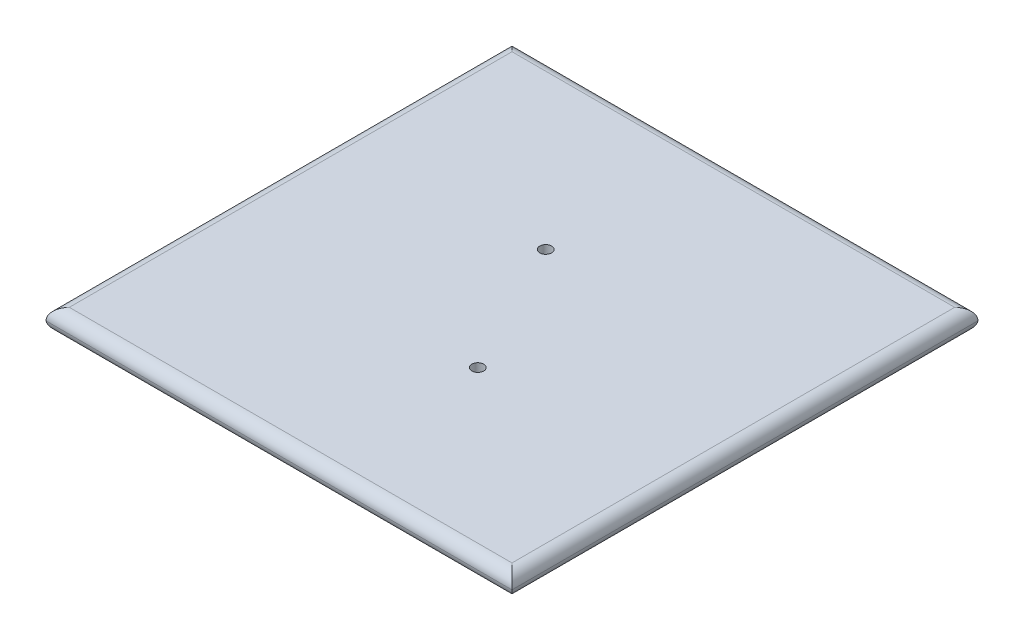
from build123d import *

# Parameters (mm, degrees)
SKETCH1_W                  = 53.594
SKETCH1_H                  = 46.99
BOSS_EXTRUDE1_DEPTH        = 12.7
CUT_EXTRUDE1_DEPTH         = 62.251008522
SKETCH3_W                  = 4.953
SKETCH3_H                  = 9.653808373
CUT_EXTRUDE2_DEPTH         = 56.564640816
SKETCH4_W                  = 53.594
SKETCH4_H                  = 46.99
BOSS_EXTRUDE2_DEPTH        = 3.175
SKETCH5_W                  = 101.6
SKETCH5_H                  = 101.6
BOSS_EXTRUDE3_DEPTH        = 4.7625
FILLET1_R                  = 7.62
SKETCH6_W                  = 41.148
SKETCH6_H                  = 34.415052436
CUT_EXTRUDE3_DEPTH         = 15.875
F_2_6_2_6_DIAMETER_HOLE1_D = 2.6
FILLET2_R                  = 2.54
FILLET3_R                  = 2.54
FILLET4_R                  = 2.54
BOSS_EXTRUDE4_REACH        = 76.747
SKETCH9_W                  = 41.148
SKETCH9_H                  = 21.115558174
FILLET5_R                  = 2.54


with BuildPart() as part:
    # Sketch1 → Boss-Extrude1 (new body)
    with BuildSketch(Plane(origin=(0, 0, 0), x_dir=(1, 0, 0), z_dir=(0, 1, 0))):
        Rectangle(SKETCH1_W, SKETCH1_H)
    extrude(amount=BOSS_EXTRUDE1_DEPTH)

    # Sketch2 → Cut-Extrude1 (cut, through all)
    with BuildSketch(Plane(origin=(-26.797, 0, -3.302), x_dir=(0, 0, -1), z_dir=(1, 0, 0))):
        Polygon((-25.781, 0), (-21.779526218, 8.503564639), (-21.779526218, 9.653808373), (-26.797, 9.653808373), (-26.797, 0), align=None)
        Polygon((19.177, 0), (20.193, 0), (20.193, 9.653808373), (15.175526218, 9.653808373), (15.175526218, 8.503564639), align=None)
    extrude(amount=CUT_EXTRUDE1_DEPTH, mode=Mode.SUBTRACT)

    # Sketch3 → Cut-Extrude2 (cut, through all)
    with BuildSketch(Plane.XY.offset(23.495)):
        with Locations((-24.3205, 4.826904187)):
            Rectangle(SKETCH3_W, SKETCH3_H)
        with Locations((24.3205, 4.826904187)):
            Rectangle(SKETCH3_W, SKETCH3_H)
    extrude(amount=-CUT_EXTRUDE2_DEPTH, mode=Mode.SUBTRACT)

    # Sketch4 → Boss-Extrude2 (add)
    with BuildSketch(Plane(origin=(0, 12.7, 0), x_dir=(1, 0, 0), z_dir=(0, 1, 0))):
        Rectangle(SKETCH4_W, SKETCH4_H)
    extrude(amount=BOSS_EXTRUDE2_DEPTH)

    # Sketch5 → Boss-Extrude3 (add)
    with BuildSketch(Plane(origin=(0, 15.875, 0), x_dir=(1, 0, 0), z_dir=(0, 1, 0))):
        Rectangle(SKETCH5_W, SKETCH5_H)
    extrude(amount=BOSS_EXTRUDE3_DEPTH)

    # Fillet1
    # the kernel refuses this fillet: 7.62 mm, written as the material it adds along each edge
    with BuildSketch(Plane(origin=(-26.797, 15.875, -23.495), x_dir=(-1, 0, 0), z_dir=(0, 0, 1)), Plane(origin=(26.797, 15.875, 23.495), x_dir=(1, 0, 0), z_dir=(0, 0, -1))) as fillet1_piece_1:
        with BuildLine():
            CenterArc((7.490509671, 7.62), FILLET1_R, 190.577809731, 79.422190269)
            Line((0, 6.221191627), (-0.149810193, 6.19321546))
            ThreePointArc((-0.149810193, 6.19321546), (-0.1524, 3.110595814), (-0.1524, 0))
            Line((-0.1524, 0), (0, -0.1524))
            Line((0, -0.1524), (7.490509671, -0.1524))
            Line((7.490509671, -0.1524), (7.490509671, 0))
        make_face()
    extrude(amount=46.99)
    with BuildSketch(Plane(origin=(26.797, 15.875, -23.495), x_dir=(0, 0, -1), z_dir=(-1, 0, 0)), Plane(origin=(-26.797, 15.875, 23.495), x_dir=(0, 0, 1), z_dir=(1, 0, 0))) as fillet1_piece_2:
        with BuildLine():
            CenterArc((7.490509671, 7.62), FILLET1_R, 190.577809731, 79.422190269)
            Line((0, 6.221191627), (-0.149810193, 6.19321546))
            ThreePointArc((-0.149810193, 6.19321546), (-0.1524, 3.110595814), (-0.1524, 0))
            Line((-0.1524, 0), (0, -0.1524))
            Line((0, -0.1524), (7.490509671, -0.1524))
            Line((7.490509671, -0.1524), (7.490509671, 0))
        make_face()
    extrude(amount=53.594)
    with BuildSketch(Plane(origin=(26.797, 15.875, -23.495), x_dir=(0, 0, -1), z_dir=(-1, 0, 0))) as fillet1_piece_3a_section:
        with BuildLine():
            CenterArc((7.490509671, 7.62), FILLET1_R, 190.577809731, 79.422190269)
            Line((0, 6.221191627), (-0.149810193, 6.19321546))
            ThreePointArc((-0.149810193, 6.19321546), (-0.1524, 3.110595814), (-0.1524, 0))
            Line((-0.1524, 0), (0, -0.1524))
            Line((0, -0.1524), (7.490509671, -0.1524))
            Line((7.490509671, -0.1524), (7.490509671, 0))
        make_face()
    fillet1_piece_3a = extrude(amount=72.320274178, mode=Mode.PRIVATE)
    fillet1_piece_3a = split(fillet1_piece_3a, bisect_by=Plane(origin=(-26.797, 15.875, -23.495), z_dir=(-1, 0, 0)), keep=Keep.TOP, mode=Mode.PRIVATE)
    with BuildSketch(Plane(origin=(-26.797, 15.875, -42.221274178), x_dir=(-1, 0, 0), z_dir=(0, 0, 1))) as fillet1_piece_3b_section:
        with BuildLine():
            CenterArc((7.490509671, 7.62), FILLET1_R, 190.577809731, 79.422190269)
            Line((0, 6.221191627), (-0.149810193, 6.19321546))
            ThreePointArc((-0.149810193, 6.19321546), (-0.1524, 3.110595814), (-0.1524, 0))
            Line((-0.1524, 0), (0, -0.1524))
            Line((0, -0.1524), (7.490509671, -0.1524))
            Line((7.490509671, -0.1524), (7.490509671, 0))
        make_face()
    fillet1_piece_3b = extrude(amount=65.716274178, mode=Mode.PRIVATE)
    fillet1_piece_3b = split(fillet1_piece_3b, bisect_by=Plane(origin=(-26.797, 15.875, -23.495), z_dir=(0, 0, -1)), keep=Keep.TOP, mode=Mode.PRIVATE)
    fillet1_piece_3 = fillet1_piece_3a & fillet1_piece_3b
    add(fillet1_piece_3)
    with BuildSketch(Plane(origin=(-45.523274178, 15.875, 23.495), x_dir=(0, 0, 1), z_dir=(1, 0, 0))) as fillet1_piece_4a_section:
        with BuildLine():
            CenterArc((7.490509671, 7.62), FILLET1_R, 190.577809731, 79.422190269)
            Line((0, 6.221191627), (-0.149810193, 6.19321546))
            ThreePointArc((-0.149810193, 6.19321546), (-0.1524, 3.110595814), (-0.1524, 0))
            Line((-0.1524, 0), (0, -0.1524))
            Line((0, -0.1524), (7.490509671, -0.1524))
            Line((7.490509671, -0.1524), (7.490509671, 0))
        make_face()
    fillet1_piece_4a = extrude(amount=72.320274178, mode=Mode.PRIVATE)
    fillet1_piece_4a = split(fillet1_piece_4a, bisect_by=Plane(origin=(-26.797, 15.875, 23.495), z_dir=(-1, 0, 0)), keep=Keep.TOP, mode=Mode.PRIVATE)
    with BuildSketch(Plane(origin=(-26.797, 15.875, -23.495), x_dir=(-1, 0, 0), z_dir=(0, 0, 1))) as fillet1_piece_4b_section:
        with BuildLine():
            CenterArc((7.490509671, 7.62), FILLET1_R, 190.577809731, 79.422190269)
            Line((0, 6.221191627), (-0.149810193, 6.19321546))
            ThreePointArc((-0.149810193, 6.19321546), (-0.1524, 3.110595814), (-0.1524, 0))
            Line((-0.1524, 0), (0, -0.1524))
            Line((0, -0.1524), (7.490509671, -0.1524))
            Line((7.490509671, -0.1524), (7.490509671, 0))
        make_face()
    fillet1_piece_4b = extrude(amount=65.716274178, mode=Mode.PRIVATE)
    fillet1_piece_4b = split(fillet1_piece_4b, bisect_by=Plane(origin=(-26.797, 15.875, 23.495), z_dir=(0, 0, 1)), keep=Keep.TOP, mode=Mode.PRIVATE)
    fillet1_piece_4 = fillet1_piece_4a & fillet1_piece_4b
    add(fillet1_piece_4)
    with BuildSketch(Plane(origin=(26.797, 15.875, 23.495), x_dir=(1, 0, 0), z_dir=(0, 0, -1))) as fillet1_piece_5a_section:
        with BuildLine():
            CenterArc((7.490509671, 7.62), FILLET1_R, 190.577809731, 79.422190269)
            Line((0, 6.221191627), (-0.149810193, 6.19321546))
            ThreePointArc((-0.149810193, 6.19321546), (-0.1524, 3.110595814), (-0.1524, 0))
            Line((-0.1524, 0), (0, -0.1524))
            Line((0, -0.1524), (7.490509671, -0.1524))
            Line((7.490509671, -0.1524), (7.490509671, 0))
        make_face()
    fillet1_piece_5a = extrude(amount=65.716274178, mode=Mode.PRIVATE)
    fillet1_piece_5a = split(fillet1_piece_5a, bisect_by=Plane(origin=(26.797, 15.875, -23.495), z_dir=(0, 0, -1)), keep=Keep.TOP, mode=Mode.PRIVATE)
    with BuildSketch(Plane(origin=(45.523274178, 15.875, -23.495), x_dir=(0, 0, -1), z_dir=(-1, 0, 0))) as fillet1_piece_5b_section:
        with BuildLine():
            CenterArc((7.490509671, 7.62), FILLET1_R, 190.577809731, 79.422190269)
            Line((0, 6.221191627), (-0.149810193, 6.19321546))
            ThreePointArc((-0.149810193, 6.19321546), (-0.1524, 3.110595814), (-0.1524, 0))
            Line((-0.1524, 0), (0, -0.1524))
            Line((0, -0.1524), (7.490509671, -0.1524))
            Line((7.490509671, -0.1524), (7.490509671, 0))
        make_face()
    fillet1_piece_5b = extrude(amount=72.320274178, mode=Mode.PRIVATE)
    fillet1_piece_5b = split(fillet1_piece_5b, bisect_by=Plane(origin=(26.797, 15.875, -23.495), z_dir=(1, 0, 0)), keep=Keep.TOP, mode=Mode.PRIVATE)
    fillet1_piece_5 = fillet1_piece_5a & fillet1_piece_5b
    add(fillet1_piece_5)
    with BuildSketch(Plane(origin=(-26.797, 15.875, 23.495), x_dir=(0, 0, 1), z_dir=(1, 0, 0))) as fillet1_piece_6a_section:
        with BuildLine():
            CenterArc((7.490509671, 7.62), FILLET1_R, 190.577809731, 79.422190269)
            Line((0, 6.221191627), (-0.149810193, 6.19321546))
            ThreePointArc((-0.149810193, 6.19321546), (-0.1524, 3.110595814), (-0.1524, 0))
            Line((-0.1524, 0), (0, -0.1524))
            Line((0, -0.1524), (7.490509671, -0.1524))
            Line((7.490509671, -0.1524), (7.490509671, 0))
        make_face()
    fillet1_piece_6a = extrude(amount=72.320274178, mode=Mode.PRIVATE)
    fillet1_piece_6a = split(fillet1_piece_6a, bisect_by=Plane(origin=(26.797, 15.875, 23.495), z_dir=(1, 0, 0)), keep=Keep.TOP, mode=Mode.PRIVATE)
    with BuildSketch(Plane(origin=(26.797, 15.875, 42.221274178), x_dir=(1, 0, 0), z_dir=(0, 0, -1))) as fillet1_piece_6b_section:
        with BuildLine():
            CenterArc((7.490509671, 7.62), FILLET1_R, 190.577809731, 79.422190269)
            Line((0, 6.221191627), (-0.149810193, 6.19321546))
            ThreePointArc((-0.149810193, 6.19321546), (-0.1524, 3.110595814), (-0.1524, 0))
            Line((-0.1524, 0), (0, -0.1524))
            Line((0, -0.1524), (7.490509671, -0.1524))
            Line((7.490509671, -0.1524), (7.490509671, 0))
        make_face()
    fillet1_piece_6b = extrude(amount=65.716274178, mode=Mode.PRIVATE)
    fillet1_piece_6b = split(fillet1_piece_6b, bisect_by=Plane(origin=(26.797, 15.875, 23.495), z_dir=(0, 0, 1)), keep=Keep.TOP, mode=Mode.PRIVATE)
    fillet1_piece_6 = fillet1_piece_6a & fillet1_piece_6b
    add(fillet1_piece_6)

    # Sketch6 → Cut-Extrude3 (cut)
    with BuildSketch(Plane.XZ):
        Rectangle(SKETCH6_W, SKETCH6_H)
    extrude(amount=-CUT_EXTRUDE3_DEPTH, mode=Mode.SUBTRACT)

    # Ø2.6 (2.6) Diameter Hole1 (through all)
    with Locations(Plane(origin=(0, 20.6375, 0), x_dir=(1, 0, 0), z_dir=(0, 1, 0))):
        with Locations((-7.25, 14.6), (7.65, -15.1)):
            Hole(F_2_6_2_6_DIAMETER_HOLE1_D / 2)

    # Fillet2
    fillet2_edges = [part.edges().sort_by_distance(p)[0] for p in [
        (50.8, 20.6375, 0),
        (0, 20.6375, -50.8),
        (-50.8, 20.6375, 0),
        (0, 20.6375, 50.8),
    ]]
    fillet(fillet2_edges, radius=FILLET2_R)

    # Fillet3
    # the kernel refuses this fillet: 2.54 mm, written as the material it takes off along each edge
    with BuildSketch(Plane(origin=(57.100195309, 15.875, -50.8), x_dir=(0, 0, 1), z_dir=(-1, 0, 0)), Plane(origin=(50.8, 15.875, 57.100195309), x_dir=(-1, 0, 0), z_dir=(0, 0, -1))) as fillet3_piece_1:
        with BuildLine():
            CenterArc((2.520078124, 2.54), FILLET3_R, 187.180755781, 82.819244219)
            Line((0, 2.2225), (-0.050401562, 2.21615))
            ThreePointArc((-0.050401562, 2.21615), (-0.0508, 1.11125), (-0.0508, 0))
            Line((-0.0508, 0), (0, -0.0508))
            Line((0, -0.0508), (2.520078124, -0.0508))
            Line((2.520078124, -0.0508), (2.520078124, 0))
        make_face()
    extrude(amount=114.200390619, mode=Mode.SUBTRACT)
    with BuildSketch(Plane(origin=(-50.8, 15.875, -57.100195309), x_dir=(0, 1, 0), z_dir=(0, 0, 1)), Plane(origin=(-57.100195309, 15.875, 50.8), x_dir=(0, 1, 0), z_dir=(1, 0, 0))) as fillet3_piece_2:
        with BuildLine():
            CenterArc((2.54, -2.520078124), FILLET3_R, 97.180755781, 82.819244219)
            Line((0, -2.520078124), (-0.0508, -2.520078124))
            Line((-0.0508, -2.520078124), (-0.0508, 0))
            Line((-0.0508, 0), (0, 0.0508))
            ThreePointArc((0, 0.0508), (1.11125, 0.0508), (2.21615, 0.050401562))
            Line((2.21615, 0.050401562), (2.2225, 0))
        make_face()
    extrude(amount=114.200390619, mode=Mode.SUBTRACT)

    # Fillet4
    fillet4_edges = [part.edges().sort_by_distance(p)[0] for p in [
        (20.574, 7.9375, 17.207526218),
        (20.574, 7.9375, -17.207526218),
        (-20.574, 7.9375, -17.207526218),
        (-20.574, 7.9375, 17.207526218),
    ]]
    fillet(fillet4_edges, radius=FILLET4_R)

    # Sketch9 → Boss-Extrude4 (add, up to next)
    with BuildSketch(Plane.XZ, mode=Mode.PRIVATE) as boss_extrude4_sk1:
        Rectangle(SKETCH9_W, SKETCH9_H)
    boss_extrude4_tool1 = extrude(boss_extrude4_sk1.sketch, amount=-BOSS_EXTRUDE4_REACH, mode=Mode.PRIVATE) - part.part
    add(boss_extrude4_tool1.solids().sort_by_distance((0, 0, 0))[0])

    # Fillet5
    fillet5_edges = [part.edges().sort_by_distance(p)[0] for p in [
        (-20.574, 7.9375, 10.557779087),
        (20.574, 7.9375, -10.557779087),
        (-20.574, 7.9375, -10.557779087),
        (20.574, 7.9375, 10.557779087),
    ]]
    fillet(fillet5_edges, radius=FILLET5_R)


solid = part.part
